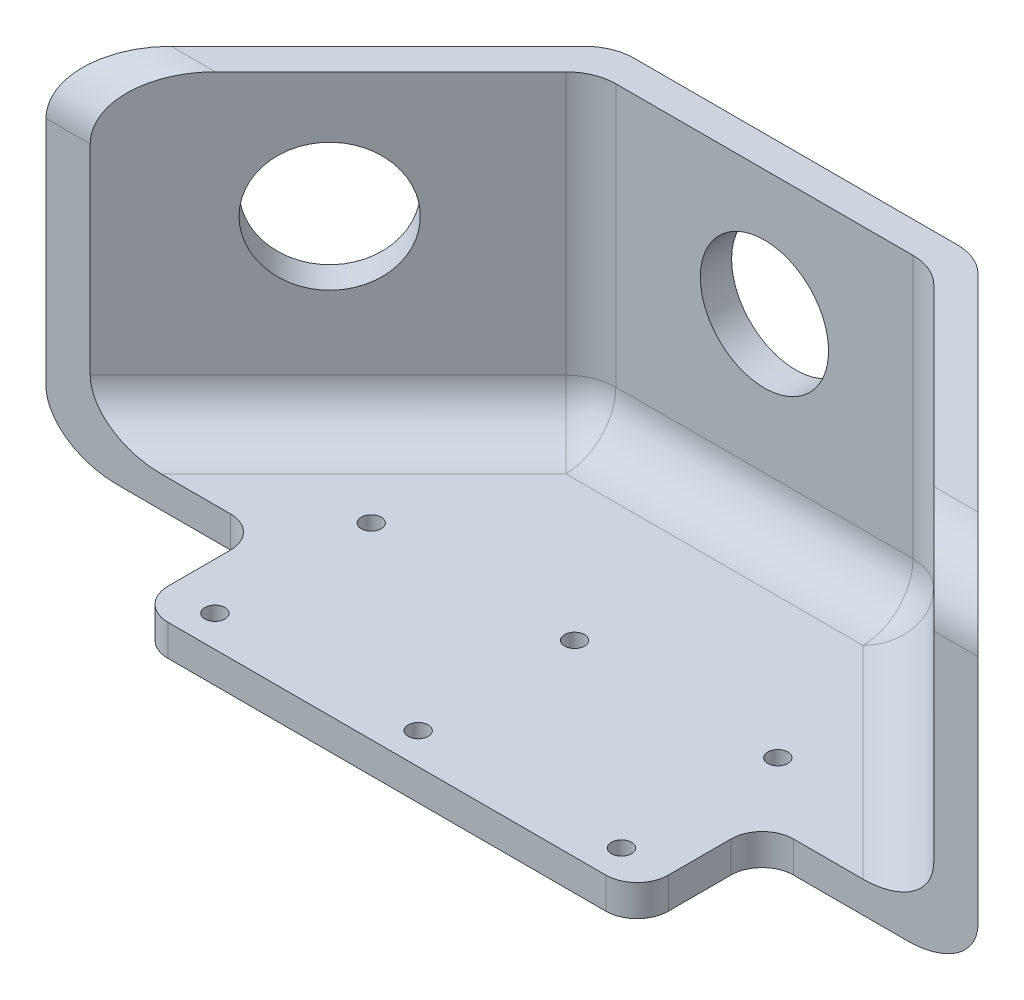
from build123d import *

# Parameters (mm, degrees)
BOSS_EXTRUDE1_DEPTH = 5
BOSS_EXTRUDE2_DEPTH = 50
CUT_EXTRUDE1_DEPTH  = 10
SKETCH6_R           = 10.25
CUT_EXTRUDE2_DEPTH  = 10
SKETCH7_R           = 10.25
CUT_EXTRUDE3_DEPTH  = 10
SKETCH8_R           = 1.6
CUT_EXTRUDE4_DEPTH  = 10
FILLET1_R           = 8
SKETCH10_W          = 80
SKETCH10_H          = 20
SKETCH10_R          = 1.6
BOSS_EXTRUDE5_DEPTH = 5
FILLET4_R           = 5
FILLET5_R           = 10


with BuildPart() as part:
    # Sketch2 → Boss-Extrude1 (new body)
    with BuildSketch(Plane(origin=(0, 0, 0), x_dir=(1, 0, 0), z_dir=(0, 1, 0))):
        Polygon((-14.142135624, 0), (0, 0), (35.355339059, 35.355339059), (85.355339059, 35.355339059), (120.710678119, 0), (134.852813742, 0), (89.497474683, 45.355339059), (31.213203436, 45.355339059), align=None)
        Polygon((85.355339059, 35.355339059), (35.355339059, 35.355339059), (0, 0), (120.710678119, 0), align=None)
    extrude(amount=BOSS_EXTRUDE1_DEPTH)

    # Sketch3 → Boss-Extrude2 (add)
    with BuildSketch(Plane(origin=(0, 5, 0), x_dir=(1, 0, 0), z_dir=(0, 1, 0))):
        Polygon((-14.142135624, 0), (31.213203436, 45.355339059), (89.497474683, 45.355339059), (134.852813742, 0), (127.781745931, 0), (87.426406871, 40.355339059), (33.284271247, 40.355339059), (-7.071067812, 0), align=None)
    extrude(amount=BOSS_EXTRUDE2_DEPTH)

    # Sketch5 → Cut-Extrude1 (cut)
    with BuildSketch(Plane(origin=(0, 0, -45.355339059), x_dir=(-1, 0, 0), z_dir=(0, 0, -1))):
        with BuildLine():
            ThreePointArc((-50.105339059, 35), (-60.355339059, 45.25), (-70.605339059, 35))
            Line((-70.605339059, 35), (-50.105339059, 35))
        make_face()
        with BuildLine():
            Line((-50.105339059, 35), (-70.605339059, 35))
            ThreePointArc((-70.605339059, 35), (-60.355339059, 24.75), (-50.105339059, 35))
        make_face()
    extrude(amount=-CUT_EXTRUDE1_DEPTH, mode=Mode.SUBTRACT)

    # Sketch6 → Cut-Extrude2 (cut)
    with BuildSketch(Plane(origin=(67.426406871, 0, -67.426406871), x_dir=(-0.7071067811865509, 0, -0.7071067811865441), z_dir=(0.7071067811865441, 0, -0.7071067811865509))):
        with Locations((-63.284271247, 35)):
            Circle(SKETCH6_R)
    extrude(amount=-CUT_EXTRUDE2_DEPTH, mode=Mode.SUBTRACT)

    # Sketch7 → Cut-Extrude3 (cut)
    with BuildSketch(Plane(origin=(-7.071067812, 0, -7.071067812), x_dir=(-0.7071067811865513, 0, 0.7071067811865438), z_dir=(-0.7071067811865438, 0, -0.7071067811865513))):
        with Locations((-22.071067812, 35)):
            Circle(SKETCH7_R)
    extrude(amount=-CUT_EXTRUDE3_DEPTH, mode=Mode.SUBTRACT)

    # Sketch8 → Cut-Extrude4 (cut)
    with BuildSketch(Plane(origin=(0, 5, 0), x_dir=(1, 0, 0), z_dir=(0, 1, 0))):
        with Locations(Location((60.355339059, 10, 0), (0, 0, 270))):
            Circle(SKETCH8_R)
        with Locations(Location((92.855339059, 10, 0), (0, 0, 270))):
            Circle(SKETCH8_R)
        with Locations(Location((27.855339059, 10, 0), (0, 0, 270))):
            Circle(SKETCH8_R)
    extrude(amount=-CUT_EXTRUDE4_DEPTH, mode=Mode.SUBTRACT)

    # Fillet1
    fillet1_edges = [part.edges().sort_by_distance(p)[0] for p in [
        (13.106601718, 5, -20.17766953),
        (60.355339059, 5, -40.355339059),
        (33.284271247, 30, -40.355339059),
        (107.604076401, 5, -20.17766953),
        (87.426406871, 30, -40.355339059),
        (60.355339059, 0, -45.355339059),
        (112.175144213, 0, -22.67766953),
        (8.535533906, 0, -22.67766953),
        (31.213203436, 27.5, -45.355339059),
        (89.497474683, 27.5, -45.355339059),
    ]]
    fillet(fillet1_edges, radius=FILLET1_R)

    # Sketch10 → Boss-Extrude5 (add)
    with BuildSketch(Plane(origin=(0, 5, 0), x_dir=(1, 0, 0), z_dir=(0, 1, 0))):
        with Locations((60.355339059, -10)):
            Rectangle(SKETCH10_W, SKETCH10_H)
        with Locations(Location((60.355339059, -15, 0), (0, 0, 270))):
            Circle(SKETCH10_R, mode=Mode.SUBTRACT)
        with Locations(Location((92.855339059, -15, 0), (0, 0, 270))):
            Circle(SKETCH10_R, mode=Mode.SUBTRACT)
        with Locations(Location((27.855339059, -15, 0), (0, 0, 270))):
            Circle(SKETCH10_R, mode=Mode.SUBTRACT)
    extrude(amount=-BOSS_EXTRUDE5_DEPTH)

    # Fillet4
    fillet4_edges = [part.edges().sort_by_distance(p)[0] for p in [
        (100.355339059, 2.5, 20),
        (100.355339059, 2.5, 0),
        (20.355339059, 2.5, 0),
        (20.355339059, 2.5, 20),
    ]]
    fillet(fillet4_edges, radius=FILLET4_R)

    # Fillet5
    # the kernel refuses this fillet: 10 mm, written as the material it takes off along each edge
    with BuildSketch(Plane(origin=(17.928932188, 55, 0), x_dir=(0, -1, 0), z_dir=(-1, 0, 0))) as fillet5_piece_1:
        with BuildLine():
            CenterArc((FILLET5_R, -FILLET5_R), FILLET5_R, 90, 90)
            Line((0, -FILLET5_R), (0, 0))
            Line((0, 0), (FILLET5_R, 0))
        make_face()
    extrude(amount=57.071067812, mode=Mode.SUBTRACT)
    with BuildSketch(Plane(origin=(159.852813742, 55, 0), x_dir=(0, 0, -1), z_dir=(-1, 0, 0))) as fillet5_piece_2:
        with BuildLine():
            CenterArc((FILLET5_R, FILLET5_R), FILLET5_R, 180, 90)
            Line((0, FILLET5_R), (0, 0))
            Line((0, 0), (FILLET5_R, 0))
        make_face()
    extrude(amount=57.071067812, mode=Mode.SUBTRACT)


solid = part.part
